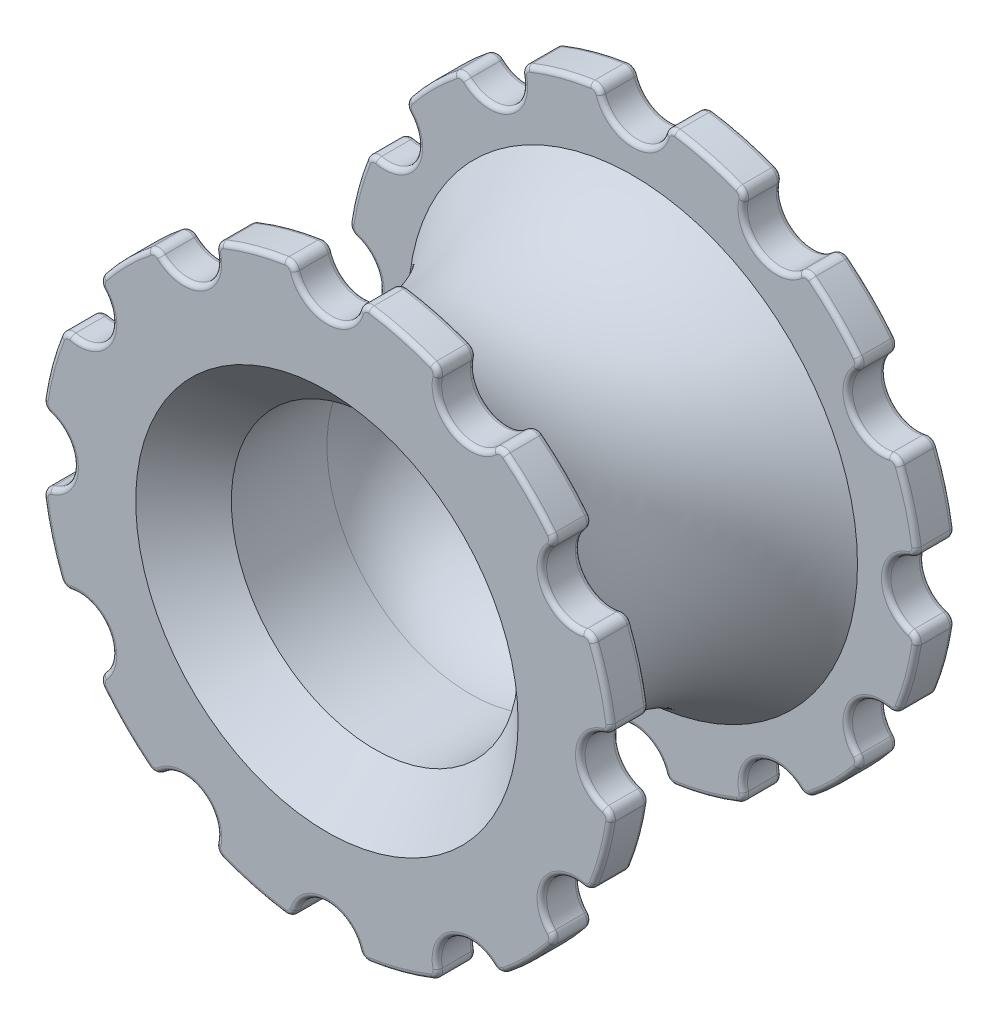
from build123d import *

# Parameters (mm, degrees)
EXTRUDE_1_DEPTH     = 36
FILLET_1_R          = 1
SKETCH_3_R          = 15
CUT_EXTRUDE_1_DEPTH = 25
FILLET_2_R          = 0.5
FILLET_3_R          = 10
CHAMFER_1_SIZE      = 5
SKETCH_4_R          = 6
EXTRUDE_2_DEPTH     = 1.5
SKETCH_5_R          = 4.75
EXTRUDE_3_DEPTH     = 4.25
SKETCH_6_R          = 1.5
CUT_EXTRUDE_2_DEPTH = 38


with BuildPart() as part:
    # Эскиз1 → Бобышка-Вытянуть1 (new body)
    with BuildSketch(Plane.XY):
        with BuildLine():
            ThreePointArc((-3.494040064, 29.795833333), (0, 26.5), (3.494040064, 29.795833333))
            ThreePointArc((3.494040064, 29.795833333), (7.764571353, 28.977774789), (11.871989209, 27.550968626))
            ThreePointArc((11.871989209, 27.550968626), (13.25, 22.9496732), (17.923844124, 24.056928561))
            ThreePointArc((17.923844124, 24.056928561), (21.213203436, 21.213203436), (24.056928561, 17.923844124))
            ThreePointArc((24.056928561, 17.923844124), (22.9496732, 13.25), (27.550968626, 11.871989209))
            ThreePointArc((27.550968626, 11.871989209), (28.977774789, 7.764571353), (29.795833333, 3.494040064))
            ThreePointArc((29.795833333, 3.494040064), (26.5, 0), (29.795833333, -3.494040064))
            ThreePointArc((29.795833333, -3.494040064), (28.977774789, -7.764571353), (27.550968626, -11.871989209))
            ThreePointArc((27.550968626, -11.871989209), (22.9496732, -13.25), (24.056928561, -17.923844124))
            ThreePointArc((24.056928561, -17.923844124), (21.213203436, -21.213203436), (17.923844124, -24.056928561))
            ThreePointArc((17.923844124, -24.056928561), (13.25, -22.9496732), (11.871989209, -27.550968626))
            ThreePointArc((11.871989209, -27.550968626), (7.764571353, -28.977774789), (3.494040064, -29.795833333))
            ThreePointArc((3.494040064, -29.795833333), (0, -26.5), (-3.494040064, -29.795833333))
            ThreePointArc((-3.494040064, -29.795833333), (-7.764571353, -28.977774789), (-11.871989209, -27.550968626))
            ThreePointArc((-11.871989209, -27.550968626), (-13.25, -22.9496732), (-17.923844124, -24.056928561))
            ThreePointArc((-17.923844124, -24.056928561), (-21.213203436, -21.213203436), (-24.056928561, -17.923844124))
            ThreePointArc((-24.056928561, -17.923844124), (-22.9496732, -13.25), (-27.550968626, -11.871989209))
            ThreePointArc((-27.550968626, -11.871989209), (-28.977774789, -7.764571353), (-29.795833333, -3.494040064))
            ThreePointArc((-29.795833333, -3.494040064), (-26.5, 0), (-29.795833333, 3.494040064))
            ThreePointArc((-29.795833333, 3.494040064), (-28.977774789, 7.764571353), (-27.550968626, 11.871989209))
            ThreePointArc((-27.550968626, 11.871989209), (-22.9496732, 13.25), (-24.056928561, 17.923844124))
            ThreePointArc((-24.056928561, 17.923844124), (-21.213203436, 21.213203436), (-17.923844124, 24.056928561))
            ThreePointArc((-17.923844124, 24.056928561), (-13.25, 22.9496732), (-11.871989209, 27.550968626))
            ThreePointArc((-11.871989209, 27.550968626), (-7.764571353, 28.977774789), (-3.494040064, 29.795833333))
        make_face()
    extrude(amount=EXTRUDE_1_DEPTH)

    # Скругление1
    fillet_1_edges = [part.edges().sort_by_distance(p)[0] for p in [
        (3.494040064, 29.795833333, 18),
        (11.871989209, 27.550968626, 18),
        (17.923844124, 24.056928561, 18),
        (29.795833333, 3.494040064, 18),
        (27.550968626, 11.871989209, 18),
        (24.056928561, 17.923844124, 18),
        (29.795833333, -3.494040064, 18),
        (27.550968626, -11.871989209, 18),
        (17.923844124, -24.056928561, 18),
        (24.056928561, -17.923844124, 18),
        (11.871989209, -27.550968626, 18),
        (-11.871989209, -27.550968626, 18),
        (3.494040064, -29.795833333, 18),
        (-3.494040064, -29.795833333, 18),
        (-17.923844124, -24.056928561, 18),
        (-24.056928561, -17.923844124, 18),
        (-27.550968626, -11.871989209, 18),
        (-29.795833333, -3.494040064, 18),
        (-29.795833333, 3.494040064, 18),
        (-27.550968626, 11.871989209, 18),
        (-24.056928561, 17.923844124, 18),
        (-17.923844124, 24.056928561, 18),
        (-11.871989209, 27.550968626, 18),
        (-3.494040064, 29.795833333, 18),
    ]]
    fillet(fillet_1_edges, radius=FILLET_1_R)

    # Эскиз2 → Вырез-Повернуть1 (revolve, cut)
    with BuildSketch(Plane(origin=(0, 0, 0), x_dir=(1, 0, 0), z_dir=(0, 1, 0))):
        with BuildLine():
            Line((-30, -4), (-30, -32))
            Line((-30, -32), (-23.5, -32))
            ThreePointArc((-23.5, -32), (-17.782856857, -18), (-23.5, -4))
            Line((-23.5, -4), (-30, -4))
        make_face()
    revolve(axis=Axis((0, 0, 1000), (0, 0, -1)), mode=Mode.SUBTRACT)

    # Эскиз3 → Вырез-Вытянуть1 (cut)
    with BuildSketch(Plane.XY.offset(36)):
        Circle(SKETCH_3_R)
    extrude(amount=-CUT_EXTRUDE_1_DEPTH, mode=Mode.SUBTRACT)

    # Скругление2
    fillet_2_edges = [part.edges().sort_by_distance(p)[0] for p in [
        (-29.525356682, -3.768908965, 4),
        (-26.5, 0, 4),
        (-29.525356682, 3.768908965, 4),
        (-28.977774789, 7.764571353, 4),
        (-27.454163425, 11.498707433, 4),
        (-22.9496732, 13.25, 4),
        (-23.68525446, 18.02664925, 4),
        (-21.213203436, 21.213203436, 4),
        (-18.02664925, 23.68525446, 4),
        (-13.25, 22.9496732, 4),
        (-11.498707433, 27.454163425, 4),
        (-7.764571353, 28.977774789, 4),
        (-3.768908965, 29.525356682, 4),
        (0, 26.5, 4),
        (3.768908965, 29.525356682, 4),
        (7.764571353, 28.977774789, 4),
        (11.498707433, 27.454163425, 4),
        (13.25, 22.9496732, 4),
        (18.02664925, 23.68525446, 4),
        (21.213203436, 21.213203436, 4),
        (23.68525446, 18.02664925, 4),
        (22.9496732, 13.25, 4),
        (27.454163425, 11.498707433, 4),
        (28.977774789, 7.764571353, 4),
        (29.525356682, 3.768908965, 4),
        (26.5, 0, 4),
        (29.525356682, -3.768908965, 4),
        (28.977774789, -7.764571353, 4),
        (27.454163425, -11.498707433, 4),
        (22.9496732, -13.25, 4),
        (23.68525446, -18.02664925, 4),
        (21.213203436, -21.213203436, 4),
        (18.02664925, -23.68525446, 4),
        (13.25, -22.9496732, 4),
        (11.498707433, -27.454163425, 4),
        (7.764571353, -28.977774789, 4),
        (3.768908965, -29.525356682, 4),
        (0, -26.5, 4),
        (-3.768908965, -29.525356682, 4),
        (-7.764571353, -28.977774789, 4),
        (-11.498707433, -27.454163425, 4),
        (-13.25, -22.9496732, 4),
        (-18.02664925, -23.68525446, 4),
        (-21.213203436, -21.213203436, 4),
        (-23.68525446, -18.02664925, 4),
        (-22.9496732, -13.25, 4),
        (-27.454163425, -11.498707433, 4),
        (-29.525356682, -3.768908965, 32),
        (-26.5, 0, 32),
        (-29.525356682, 3.768908965, 32),
        (-28.977774789, 7.764571353, 32),
        (-27.454163425, 11.498707433, 32),
        (-22.9496732, 13.25, 32),
        (-23.68525446, 18.02664925, 32),
        (-21.213203436, 21.213203436, 32),
        (-18.02664925, 23.68525446, 32),
        (-13.25, 22.9496732, 32),
        (-11.498707433, 27.454163425, 32),
        (-7.764571353, 28.977774789, 32),
        (-3.768908965, 29.525356682, 32),
        (0, 26.5, 32),
        (3.768908965, 29.525356682, 32),
        (7.764571353, 28.977774789, 32),
        (11.498707433, 27.454163425, 32),
        (13.25, 22.9496732, 32),
        (18.02664925, 23.68525446, 32),
        (21.213203436, 21.213203436, 32),
        (23.68525446, 18.02664925, 32),
        (22.9496732, 13.25, 32),
        (27.454163425, 11.498707433, 32),
        (28.977774789, 7.764571353, 32),
        (29.525356682, 3.768908965, 32),
        (26.5, 0, 32),
        (29.525356682, -3.768908965, 32),
        (28.977774789, -7.764571353, 32),
        (27.454163425, -11.498707433, 32),
        (22.9496732, -13.25, 32),
        (23.68525446, -18.02664925, 32),
        (21.213203436, -21.213203436, 32),
        (18.02664925, -23.68525446, 32),
        (13.25, -22.9496732, 32),
        (11.498707433, -27.454163425, 32),
        (7.764571353, -28.977774789, 32),
        (3.768908965, -29.525356682, 32),
        (0, -26.5, 32),
        (-3.768908965, -29.525356682, 32),
        (-7.764571353, -28.977774789, 32),
        (-11.498707433, -27.454163425, 32),
        (-13.25, -22.9496732, 32),
        (-18.02664925, -23.68525446, 32),
        (-21.213203436, -21.213203436, 32),
        (-23.68525446, -18.02664925, 32),
        (-22.9496732, -13.25, 32),
        (-27.454163425, -11.498707433, 32),
        (-29.525356682, 3.768908965, 36),
        (-28.977774789, 7.764571353, 36),
        (-27.454163425, 11.498707433, 36),
        (-22.9496732, 13.25, 36),
        (-23.68525446, 18.02664925, 36),
        (-21.213203436, 21.213203436, 36),
        (-18.02664925, 23.68525446, 36),
        (-13.25, 22.9496732, 36),
        (-11.498707433, 27.454163425, 36),
        (-7.764571353, 28.977774789, 36),
        (-3.768908965, 29.525356682, 36),
        (0, 26.5, 36),
        (3.768908965, 29.525356682, 36),
        (7.764571353, 28.977774789, 36),
        (11.498707433, 27.454163425, 36),
        (13.25, 22.9496732, 36),
        (18.02664925, 23.68525446, 36),
        (21.213203436, 21.213203436, 36),
        (23.68525446, 18.02664925, 36),
        (22.9496732, 13.25, 36),
        (27.454163425, 11.498707433, 36),
        (28.977774789, 7.764571353, 36),
        (29.525356682, 3.768908965, 36),
        (26.5, 0, 36),
        (29.525356682, -3.768908965, 36),
        (28.977774789, -7.764571353, 36),
        (27.454163425, -11.498707433, 36),
        (22.9496732, -13.25, 36),
        (23.68525446, -18.02664925, 36),
        (21.213203436, -21.213203436, 36),
        (18.02664925, -23.68525446, 36),
        (13.25, -22.9496732, 36),
        (11.498707433, -27.454163425, 36),
        (7.764571353, -28.977774789, 36),
        (3.768908965, -29.525356682, 36),
        (0, -26.5, 36),
        (-3.768908965, -29.525356682, 36),
        (-7.764571353, -28.977774789, 36),
        (-11.498707433, -27.454163425, 36),
        (-13.25, -22.9496732, 36),
        (-18.02664925, -23.68525446, 36),
        (-21.213203436, -21.213203436, 36),
        (-23.68525446, -18.02664925, 36),
        (-22.9496732, -13.25, 36),
        (-27.454163425, -11.498707433, 36),
        (-28.977774789, -7.764571353, 36),
        (-29.525356682, -3.768908965, 36),
        (3.768908965, 29.525356682, 0),
        (0, 26.5, 0),
        (-3.768908965, 29.525356682, 0),
        (-7.764571353, 28.977774789, 0),
        (-11.498707433, 27.454163425, 0),
        (-13.25, 22.9496732, 0),
        (-18.02664925, 23.68525446, 0),
        (-21.213203436, 21.213203436, 0),
        (-23.68525446, 18.02664925, 0),
        (-22.9496732, 13.25, 0),
        (-27.454163425, 11.498707433, 0),
        (-28.977774789, 7.764571353, 0),
        (-29.525356682, 3.768908965, 0),
        (-26.5, 0, 0),
        (-29.525356682, -3.768908965, 0),
        (-28.977774789, -7.764571353, 0),
        (-27.454163425, -11.498707433, 0),
        (-22.9496732, -13.25, 0),
        (-23.68525446, -18.02664925, 0),
        (-21.213203436, -21.213203436, 0),
        (-18.02664925, -23.68525446, 0),
        (-13.25, -22.9496732, 0),
        (-11.498707433, -27.454163425, 0),
        (-7.764571353, -28.977774789, 0),
        (-3.768908965, -29.525356682, 0),
        (0, -26.5, 0),
        (3.768908965, -29.525356682, 0),
        (7.764571353, -28.977774789, 0),
        (11.498707433, -27.454163425, 0),
        (13.25, -22.9496732, 0),
        (18.02664925, -23.68525446, 0),
        (21.213203436, -21.213203436, 0),
        (23.68525446, -18.02664925, 0),
        (22.9496732, -13.25, 0),
        (27.454163425, -11.498707433, 0),
        (28.977774789, -7.764571353, 0),
        (29.525356682, -3.768908965, 0),
        (26.5, 0, 0),
        (29.525356682, 3.768908965, 0),
        (28.977774789, 7.764571353, 0),
        (27.454163425, 11.498707433, 0),
        (22.9496732, 13.25, 0),
        (23.68525446, 18.02664925, 0),
        (21.213203436, 21.213203436, 0),
        (18.02664925, 23.68525446, 0),
        (13.25, 22.9496732, 0),
        (11.498707433, 27.454163425, 0),
        (7.764571353, 28.977774789, 0),
        (-28.977774789, -7.764571353, 4),
        (-28.977774789, -7.764571353, 32),
        (-26.5, 0, 36),
    ]]
    fillet(fillet_2_edges, radius=FILLET_2_R)

    # Скругление3
    fillet_3_edges = [part.edges().sort_by_distance(p)[0] for p in [
        (-15, 0, 11),
    ]]
    fillet(fillet_3_edges, radius=FILLET_3_R)

    # Фаска1
    chamfer_1_edges = [part.edges().sort_by_distance(p)[0] for p in [
        (-15, 0, 36),
    ]]
    chamfer(chamfer_1_edges, length=CHAMFER_1_SIZE)

    # Эскиз4 → Бобышка-Вытянуть2 (add)
    with BuildSketch(Plane(origin=(0, 0, 0), x_dir=(-1, 0, 0), z_dir=(0, 0, -1))):
        Circle(SKETCH_4_R)
    extrude(amount=EXTRUDE_2_DEPTH)

    # Эскиз5 → Бобышка-Вытянуть3 (add)
    with BuildSketch(Plane(origin=(0, 0, -1.5), x_dir=(-1, 0, 0), z_dir=(0, 0, -1))):
        Circle(SKETCH_5_R)
    extrude(amount=EXTRUDE_3_DEPTH)

    # Эскиз6 → Вырез-Вытянуть2 (cut)
    with BuildSketch(Plane(origin=(0, 0, -5.75), x_dir=(-1, 0, 0), z_dir=(0, 0, -1))):
        Circle(SKETCH_6_R)
    extrude(amount=-CUT_EXTRUDE_2_DEPTH, mode=Mode.SUBTRACT)


solid = part.part
